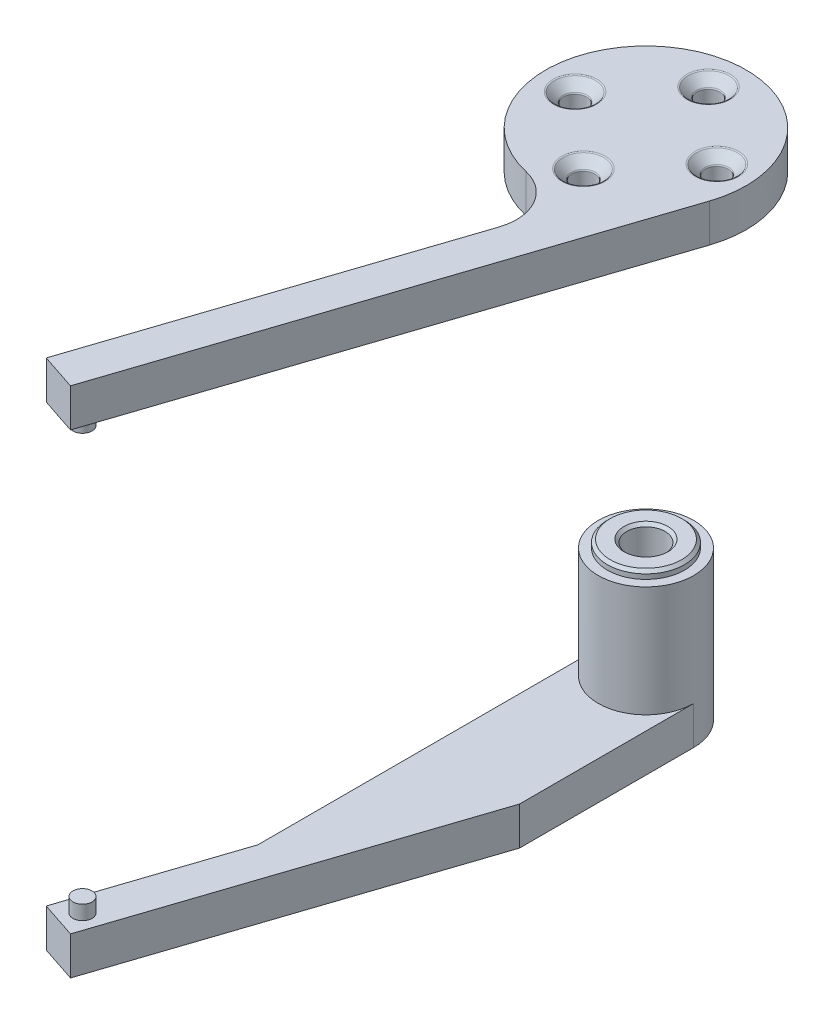
from build123d import *
from build123d.topology import SkipClean

# Parameters (mm, degrees)
SKETCH2_R                                           = 0.5
BOSS_EXTRUDE1_DEPTH                                 = 4
CSK_FOR_M2_COUNTERSUNK_FLAT_HEAD_SCREW1_D           = 2.4
CSK_FOR_M2_COUNTERSUNK_FLAT_HEAD_SCREW1_DEPTH       = 4
CSK_FOR_M2_COUNTERSUNK_FLAT_HEAD_SCREW1_CSINK_D     = 4.4
CSK_FOR_M2_COUNTERSUNK_FLAT_HEAD_SCREW1_CSINK_ANGLE = 90
CSK_FOR_M2_COUNTERSUNK_FLAT_HEAD_SCREW1_TIP         = 0.721032743
CUT_EXTRUDE1_DEPTH                                  = 1
BOSS_EXTRUDE2_START                                 = 0.2
SKETCH6_R                                           = 4.038121114
BOSS_EXTRUDE2_DEPTH                                 = 0.8
BOSS_EXTRUDE3_DEPTH                                 = 15.6
SKETCH11_R                                          = 3.75
CUT_EXTRUDE3_DEPTH                                  = 12.8
SKETCH10_R                                          = 2
CUT_EXTRUDE2_DEPTH                                  = 5
CHAMFER1_SIZE                                       = 0.3
FILLET3_R                                           = 0.2
CHAMFER2_SIZE                                       = 0.5
FILLET4_R                                           = 0.2
FILLET6_R                                           = 5
CUT_EXTRUDE4_DEPTH                                  = 11.6
SKETCH15_R                                          = 1
BOSS_EXTRUDE4_DEPTH                                 = 1.5
BOSS_EXTRUDE5_DEPTH                                 = 1.5
BOSS_EXTRUDE5_DEPTH_BACK                            = 4
SKETCH16_R                                          = 1


with BuildPart() as part:
    # Sketch2 → Boss-Extrude1 (new body)
    with BuildSketch(Plane(origin=(0, 33.6, 0), x_dir=(1, 0, 0), z_dir=(0, 1, 0))):
        with BuildLine():
            Line((9.9636597, 6.387072988), (-6.733193774, -43.828873659))
            Line((-6.733193774, -43.828873659), (-10.528873659, -42.566806226))
            Line((-10.528873659, -42.566806226), (3.566161148, -0.175854124))
            ThreePointArc((3.566161148, -0.175854124), (-7.518777568, 17.029255343), (9.9636597, 6.387072988))
        make_face()
        with Locations(Location((-8, -41.3, 0), (0, 0, 270))):
            Circle(SKETCH2_R, mode=Mode.SUBTRACT)
    extrude(amount=BOSS_EXTRUDE1_DEPTH)

    # CSK for M2 Countersunk Flat Head Screw1
    with Locations(Plane(origin=(0, 37.6, 0), x_dir=(1, 0, 0), z_dir=(0, 1, 0))):
        with Locations((0.439033788, 2.713781471), (6.986218529, 10.139033788), (-0.439033788, 16.686218529), (-6.986218529, 9.260966212)):
            CounterSinkHole(CSK_FOR_M2_COUNTERSUNK_FLAT_HEAD_SCREW1_D / 2, CSK_FOR_M2_COUNTERSUNK_FLAT_HEAD_SCREW1_CSINK_D / 2, depth=CSK_FOR_M2_COUNTERSUNK_FLAT_HEAD_SCREW1_DEPTH, counter_sink_angle=CSK_FOR_M2_COUNTERSUNK_FLAT_HEAD_SCREW1_CSINK_ANGLE)
            with Locations((0, 0, -(CSK_FOR_M2_COUNTERSUNK_FLAT_HEAD_SCREW1_DEPTH + CSK_FOR_M2_COUNTERSUNK_FLAT_HEAD_SCREW1_TIP / 2))):  # 118° drill point
                Cone(0, CSK_FOR_M2_COUNTERSUNK_FLAT_HEAD_SCREW1_D / 2, CSK_FOR_M2_COUNTERSUNK_FLAT_HEAD_SCREW1_TIP, mode=Mode.SUBTRACT)

    # Sketch5 → Cut-Extrude1 (cut)
    with BuildSketch(Plane.XZ.offset(-33.6)):
        with BuildLine():
            Line((-4.5, -20.2), (-4.5, -9.7))
            ThreePointArc((-4.5, -9.7), (0, -5.2), (4.5, -9.7))
            Line((4.5, -9.7), (4.5, -20.2))
            ThreePointArc((4.5, -20.2), (0, -24.7), (-4.5, -20.2))
        make_face()
    extrude(amount=-CUT_EXTRUDE1_DEPTH, mode=Mode.SUBTRACT)

    # Chamfer2
    # the kernel refuses this chamfer: 0.5, 0.37535302 mm, written as the material it takes off along each edge
    with BuildSketch(Plane(origin=(4.5, 34.6, -19.186832981), x_dir=(0.8957520847701005, 0, 0.4445539366938715), z_dir=(0, -1, 0))) as chamfer2_piece_1:
        with BuildLine():
            Line((0.373049134, 0), (CHAMFER2_SIZE * 0.444553936694, CHAMFER2_SIZE * 0.89575208477))
            Line((CHAMFER2_SIZE * 0.444553936694, CHAMFER2_SIZE * 0.89575208477), (0, 0))
            ThreePointArc((0, 0), (0.189712645, -0.001656381), (0.373049134, 0))
        make_face()
    extrude(amount=2.285841494, mode=Mode.SUBTRACT)
    with BuildSketch(Plane(origin=(-4.5, 34.6, -19.186832981), x_dir=(-0.8957520847700934, 0, 0.4445539366938859), z_dir=(0, -1, 0))) as chamfer2_piece_2:
        with BuildLine():
            Line((0.373049134, 0), (CHAMFER2_SIZE * 0.444553936694, -CHAMFER2_SIZE * 0.89575208477))
            Line((CHAMFER2_SIZE * 0.444553936694, -CHAMFER2_SIZE * 0.89575208477), (0, 0))
            ThreePointArc((0, 0), (0.189712645, 0.001656381), (0.373049134, 0))
        make_face()
    extrude(amount=2.285841494, mode=Mode.SUBTRACT)
    with BuildSketch(Plane(origin=(0, 34.6, -9.7), x_dir=(-0.5357432905270892, 0, -0.8443809132466265), z_dir=(-0.8443809132466265, 0, 0.5357432905270892))) as chamfer2_piece_3_section:
        Polygon((10.5, -CHAMFER2_SIZE), (10.5 - CHAMFER2_SIZE, 0), (10.5, 0), align=None)
    chamfer2_piece_3 = revolve(axis=Axis((0, 34.6, -9.7), (0, -1, 0)), revolution_arc=64.788667193, mode=Mode.PRIVATE)
    chamfer2_piece_3 = split(chamfer2_piece_3, bisect_by=Plane(origin=(-4.5, 34.6, -9.7), z_dir=(1, 0, 0)), keep=Keep.TOP, mode=Mode.PRIVATE)
    chamfer2_piece_3 = split(chamfer2_piece_3, bisect_by=Plane(origin=(4.5, 34.6, -9.7), z_dir=(-1, 0, 0)), keep=Keep.TOP, mode=Mode.PRIVATE)
    add(chamfer2_piece_3, mode=Mode.SUBTRACT)
    with BuildSketch(Plane(origin=(0, 34.6, -9.7), x_dir=(-0.5357432905270892, 0, -0.8443809132466265), z_dir=(-0.8443809132466265, 0, 0.5357432905270892))) as chamfer2_piece_4a_section:
        Polygon((10.5, -CHAMFER2_SIZE), (10.5 - CHAMFER2_SIZE, 0), (10.5, 0), align=None)
    chamfer2_piece_4a = revolve(axis=Axis((0, 34.6, -9.7), (0, -1, 0)), revolution_arc=64.788667193, mode=Mode.PRIVATE)
    chamfer2_piece_4a = split(chamfer2_piece_4a, bisect_by=Plane(origin=(4.5, 34.6, -9.7), z_dir=(1, 0, 0)), keep=Keep.TOP, mode=Mode.PRIVATE)
    with BuildSketch(Plane(origin=(4.5, 35.885841494, -19.186832981), x_dir=(0.8957520847701005, 0, 0.4445539366938715), z_dir=(0, -1, 0))) as chamfer2_piece_4b_section:
        with BuildLine():
            Line((0.373049134, 0), (CHAMFER2_SIZE * 0.444553936694, CHAMFER2_SIZE * 0.89575208477))
            Line((CHAMFER2_SIZE * 0.444553936694, CHAMFER2_SIZE * 0.89575208477), (0, 0))
            ThreePointArc((0, 0), (0.189712645, -0.001656381), (0.373049134, 0))
        make_face()
    chamfer2_piece_4b = extrude(amount=3.571682988, mode=Mode.PRIVATE)
    chamfer2_piece_4b = split(chamfer2_piece_4b, bisect_by=Plane(origin=(4.5, 34.6, -19.186832981), z_dir=(0, 1, 0)), keep=Keep.TOP, mode=Mode.PRIVATE)
    chamfer2_piece_4 = chamfer2_piece_4a & chamfer2_piece_4b
    add(chamfer2_piece_4, mode=Mode.SUBTRACT)
    with BuildSketch(Plane(origin=(-4.5, 35.885841494, -19.186832981), x_dir=(-0.8957520847700934, 0, 0.4445539366938859), z_dir=(0, -1, 0))) as chamfer2_piece_5a_section:
        with BuildLine():
            Line((0.373049134, 0), (CHAMFER2_SIZE * 0.444553936694, -CHAMFER2_SIZE * 0.89575208477))
            Line((CHAMFER2_SIZE * 0.444553936694, -CHAMFER2_SIZE * 0.89575208477), (0, 0))
            ThreePointArc((0, 0), (0.189712645, 0.001656381), (0.373049134, 0))
        make_face()
    chamfer2_piece_5a = extrude(amount=3.571682988, mode=Mode.PRIVATE)
    chamfer2_piece_5a = split(chamfer2_piece_5a, bisect_by=Plane(origin=(-4.5, 34.6, -19.186832981), z_dir=(0, 1, 0)), keep=Keep.TOP, mode=Mode.PRIVATE)
    with BuildSketch(Plane(origin=(0, 34.6, -9.7), x_dir=(-0.5357432905270892, 0, -0.8443809132466265), z_dir=(-0.8443809132466265, 0, 0.5357432905270892))) as chamfer2_piece_5b_section:
        Polygon((10.5, -CHAMFER2_SIZE), (10.5 - CHAMFER2_SIZE, 0), (10.5, 0), align=None)
    chamfer2_piece_5b = revolve(axis=Axis((0, 34.6, -9.7), (0, -1, 0)), revolution_arc=64.788667193, mode=Mode.PRIVATE)
    chamfer2_piece_5b = split(chamfer2_piece_5b, bisect_by=Plane(origin=(-4.5, 34.6, -9.7), z_dir=(-1, 0, 0)), keep=Keep.TOP, mode=Mode.PRIVATE)
    chamfer2_piece_5 = chamfer2_piece_5a & chamfer2_piece_5b
    add(chamfer2_piece_5, mode=Mode.SUBTRACT)

    # Fillet4
    fillet4_edges = [part.edges().sort_by_distance(p)[0] for p in [
        (-4.786218529, 37.6, -9.260966212),
        (-5.786218529, 33.6, -9.260966212),
        (-5.786218529, 36.6, -9.260966212),
        (1.760966212, 37.6, -16.686218529),
        (0.760966212, 36.6, -16.686218529),
        (9.186218529, 37.6, -10.139033788),
        (8.186218529, 33.6, -10.139033788),
        (8.186218529, 36.6, -10.139033788),
        (2.639033788, 37.6, -2.713781471),
        (1.639033788, 33.6, -2.713781471),
        (1.639033788, 36.6, -2.713781471),
        (0.760966212, 34.6, -16.686218529),
    ]]
    fillet(fillet4_edges, radius=FILLET4_R)

    # Fillet6
    fillet6_edges = [part.edges().sort_by_distance(p)[0] for p in [
        (3.566161148, 35.6, 0.175854124),
    ]]
    fillet(fillet6_edges, radius=FILLET6_R)

    # Sketch16 → Boss-Extrude5 (add, two sides: drawn at the far end of the back side and taken through both)
    with BuildSketch(Plane.XZ.offset(-33.6).offset(-BOSS_EXTRUDE5_DEPTH_BACK)):
        with Locations(Location((-8, 41.3, 0), (0, 0, 90))):
            Circle(SKETCH16_R)
    extrude(amount=BOSS_EXTRUDE5_DEPTH + BOSS_EXTRUDE5_DEPTH_BACK)


with BuildPart() as body_2:
    # Sketch6 → Boss-Extrude2 (new body)
    with BuildSketch(Plane.XZ.offset(-0.5).offset(BOSS_EXTRUDE2_START)):
        with Locations(Location((0, -9.7, 0), (0, 0, 270))):
            Circle(SKETCH6_R)
    extrude(amount=BOSS_EXTRUDE2_DEPTH)

    # Sketch7 → Boss-Extrude3 (add)
    with BuildSketch(Plane.XZ.offset(0.5)):
        with BuildLine():
            Line((-5, -9.7), (-5, 25.938665772))
            Line((-5, 25.938665772), (-10.528873659, 42.566806226))
            Line((-10.528873659, 42.566806226), (-6.733193774, 43.828873659))
            Line((-6.733193774, 43.828873659), (5, 8.541181072))
            Line((5, 8.541181072), (5, -9.7))
            ThreePointArc((5, -9.7), (0, -14.7), (-5, -9.7))
        make_face()
    extrude(amount=BOSS_EXTRUDE3_DEPTH)

    # Sketch11 → Cut-Extrude3 (cut)
    with BuildSketch(Plane.XZ.offset(16.1)):
        with Locations(Location((0, -9.7, 0), (0, 0, 270))):
            Circle(SKETCH11_R)
    extrude(amount=-CUT_EXTRUDE3_DEPTH, mode=Mode.SUBTRACT)

    # Sketch10 → Cut-Extrude2 (cut)
    with BuildSketch(Plane.XZ.offset(3.3)):
        with Locations(Location((0, -9.7, 0), (0, 0, 270))):
            Circle(SKETCH10_R)
    extrude(amount=-CUT_EXTRUDE2_DEPTH, mode=Mode.SUBTRACT)

    # Chamfer1
    chamfer1_edges = [body_2.edges().sort_by_distance(p)[0] for p in [
        (0, 0.3, -5.661878886),
        (0, 0.3, -7.7),
    ]]
    chamfer(chamfer1_edges, length=CHAMFER1_SIZE)

    # Fillet3
    fillet3_edges = [body_2.edges().sort_by_distance(p)[0] for p in [
        (0, -3.3, -5.95),
        (0, -3.3, -7.7),
    ]]
    fillet(fillet3_edges, radius=FILLET3_R)

    # Sketch12 → Cut-Extrude4 (cut)
    with SkipClean():  # the faces are left unmerged after this step: merging them gives an invalid solid
        with BuildSketch(Plane(origin=(0, -0.5, 0), x_dir=(1, 0, 0), z_dir=(0, 1, 0))):
            with BuildLine():
                Line((-10.528873659, -42.566806226), (-6.733193774, -43.828873659))
                Line((-6.733193774, -43.828873659), (5, -8.541181072))
                Line((5, -8.541181072), (5, 9.7))
                ThreePointArc((5, 9.7), (0, 4.7), (-5, 9.7))
                Line((-5, 9.7), (-5, -25.938665772))
                Line((-5, -25.938665772), (-10.528873659, -42.566806226))
            make_face()
        extrude(amount=-CUT_EXTRUDE4_DEPTH, mode=Mode.SUBTRACT)

    # Sketch15 → Boss-Extrude4 (add)
    with SkipClean():  # the faces are left unmerged after this step: merging them gives an invalid solid
        with BuildSketch(Plane(origin=(0, -12.1, 0), x_dir=(1, 0, 0), z_dir=(0, 1, 0))):
            with Locations(Location((-8, -41.3, 0), (0, 0, 270))):
                Circle(SKETCH15_R)
        extrude(amount=BOSS_EXTRUDE4_DEPTH)


solid = Compound([part.part, body_2.part])
